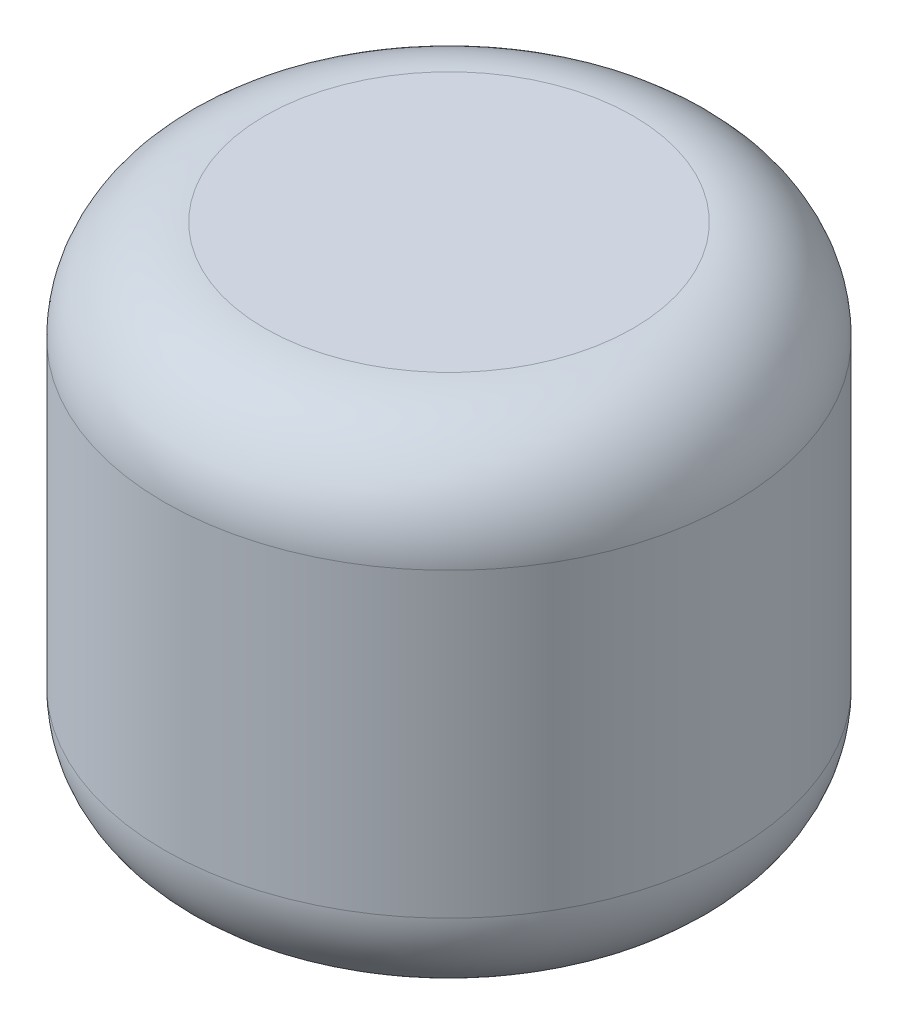
from build123d import *

# Parameters (mm, degrees)
SKETCH_1_R          = 8.5
EXTRUDE_1_DEPTH     = 15
SKETCH_2_R          = 3
CUT_EXTRUDE_1_DEPTH = 10
FILLET_1_R          = 3


with BuildPart() as part:
    # Эскиз1 → Бобышка-Вытянуть1 (new body)
    with BuildSketch(Plane(origin=(0, 0, 0), x_dir=(1, 0, 0), z_dir=(0, 1, 0))):
        Circle(SKETCH_1_R)
    extrude(amount=EXTRUDE_1_DEPTH)

    # Эскиз2 → Вырез-Вытянуть1 (cut)
    with BuildSketch(Plane.XZ):
        Circle(SKETCH_2_R)
    extrude(amount=-CUT_EXTRUDE_1_DEPTH, mode=Mode.SUBTRACT)

    # Скругление1
    fillet_1_edges = [part.edges().sort_by_distance(p)[0] for p in [
        (-8.5, 0, 0),
        (-8.5, 15, 0),
    ]]
    fillet(fillet_1_edges, radius=FILLET_1_R)


solid = part.part
